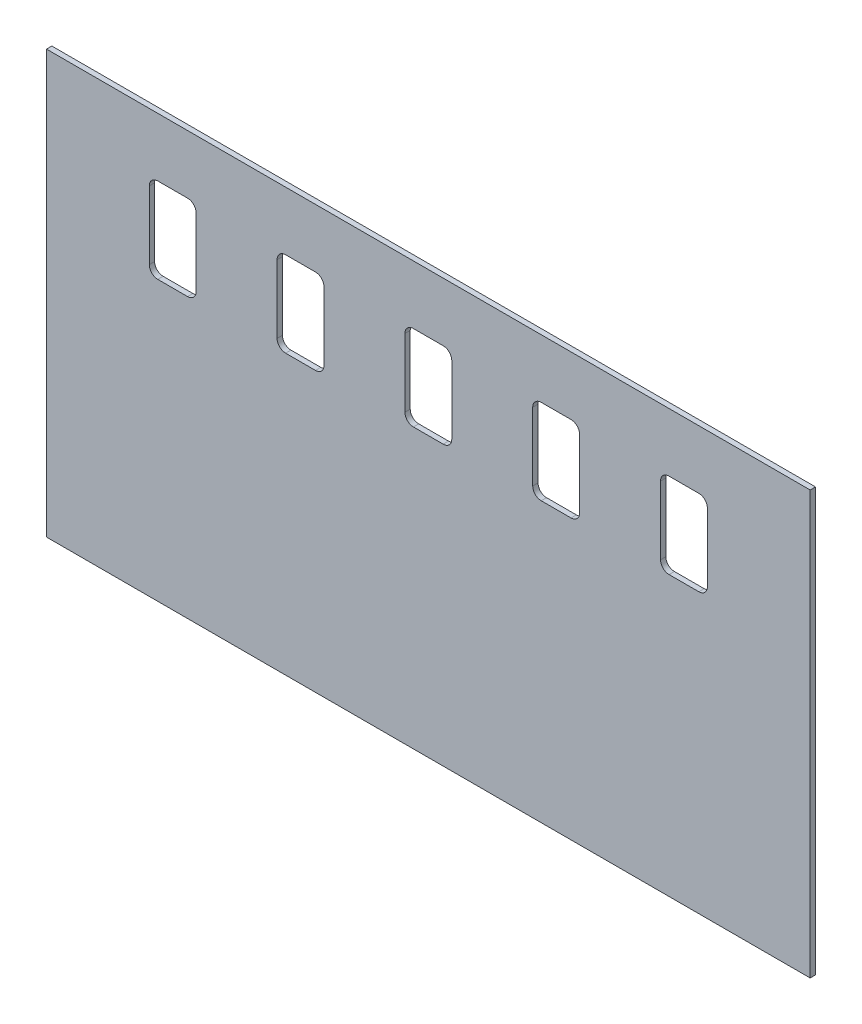
from build123d import *

# Parameters (mm, degrees)
SKETCH3_W           = 455.295
SKETCH3_H           = 251.968
BOSS_EXTRUDE1_DEPTH = 1.5875
CUT_EXTRUDE1_DEPTH  = 25.4


with BuildPart() as part:
    # Sketch3 → Boss-Extrude1 (new, symmetric)
    with BuildSketch(Plane.XY):
        Rectangle(SKETCH3_W, SKETCH3_H)
    extrude(amount=BOSS_EXTRUDE1_DEPTH, both=True)

    # Sketch4 → Cut-Extrude1 (cut)
    with BuildSketch(Plane.XY.offset(1.5875)):
        with BuildLine():
            Line((-161.29, 91.059001016), (-143.51, 91.059001016))
            ThreePointArc((-143.51, 91.059001016), (-139.917897552, 89.571103464), (-138.43, 85.979001016))
            Line((-138.43, 85.979001016), (-138.43, 45.339001016))
            ThreePointArc((-138.43, 45.339001016), (-139.917897552, 41.746898568), (-143.51, 40.259001016))
            Line((-143.51, 40.259001016), (-161.29, 40.259001016))
            ThreePointArc((-161.29, 40.259001016), (-164.882102448, 41.746898568), (-166.37, 45.339001016))
            Line((-166.37, 45.339001016), (-166.37, 85.979001016))
            ThreePointArc((-166.37, 85.979001016), (-164.882102448, 89.571103464), (-161.29, 91.059001016))
        make_face()
        with BuildLine():
            Line((-8.89, 91.059001016), (8.89, 91.059001016))
            ThreePointArc((8.89, 91.059001016), (12.482102448, 89.571103464), (13.97, 85.979001016))
            Line((13.97, 85.979001016), (13.97, 45.339001016))
            ThreePointArc((13.97, 45.339001016), (12.482102448, 41.746898568), (8.89, 40.259001016))
            Line((8.89, 40.259001016), (-8.89, 40.259001016))
            ThreePointArc((-8.89, 40.259001016), (-12.482102448, 41.746898568), (-13.97, 45.339001016))
            Line((-13.97, 45.339001016), (-13.97, 85.979001016))
            ThreePointArc((-13.97, 85.979001016), (-12.482102448, 89.571103464), (-8.89, 91.059001016))
        make_face()
        with BuildLine():
            Line((67.31, 91.059001016), (85.09, 91.059001016))
            ThreePointArc((85.09, 91.059001016), (88.682102448, 89.571103464), (90.17, 85.979001016))
            Line((90.17, 85.979001016), (90.17, 45.339001016))
            ThreePointArc((90.17, 45.339001016), (88.682102448, 41.746898568), (85.09, 40.259001016))
            Line((85.09, 40.259001016), (67.31, 40.259001016))
            ThreePointArc((67.31, 40.259001016), (63.717897552, 41.746898568), (62.23, 45.339001016))
            Line((62.23, 45.339001016), (62.23, 85.979001016))
            ThreePointArc((62.23, 85.979001016), (63.717897552, 89.571103464), (67.31, 91.059001016))
        make_face()
        with BuildLine():
            Line((143.51, 91.059001016), (161.29, 91.059001016))
            ThreePointArc((161.29, 91.059001016), (164.882102448, 89.571103464), (166.37, 85.979001016))
            Line((166.37, 85.979001016), (166.37, 45.339001016))
            ThreePointArc((166.37, 45.339001016), (164.882102448, 41.746898568), (161.29, 40.259001016))
            Line((161.29, 40.259001016), (143.51, 40.259001016))
            ThreePointArc((143.51, 40.259001016), (139.917897552, 41.746898568), (138.43, 45.339001016))
            Line((138.43, 45.339001016), (138.43, 85.979001016))
            ThreePointArc((138.43, 85.979001016), (139.917897552, 89.571103464), (143.51, 91.059001016))
        make_face()
        with BuildLine():
            Line((-85.09, 91.059001016), (-67.31, 91.059001016))
            ThreePointArc((-67.31, 91.059001016), (-63.717897552, 89.571103464), (-62.23, 85.979001016))
            Line((-62.23, 85.979001016), (-62.23, 45.339001016))
            ThreePointArc((-62.23, 45.339001016), (-63.717897552, 41.746898568), (-67.31, 40.259001016))
            Line((-67.31, 40.259001016), (-85.09, 40.259001016))
            ThreePointArc((-85.09, 40.259001016), (-88.682102448, 41.746898568), (-90.17, 45.339001016))
            Line((-90.17, 45.339001016), (-90.17, 85.979001016))
            ThreePointArc((-90.17, 85.979001016), (-88.682102448, 89.571103464), (-85.09, 91.059001016))
        make_face()
    extrude(amount=-CUT_EXTRUDE1_DEPTH, mode=Mode.SUBTRACT)


solid = part.part
